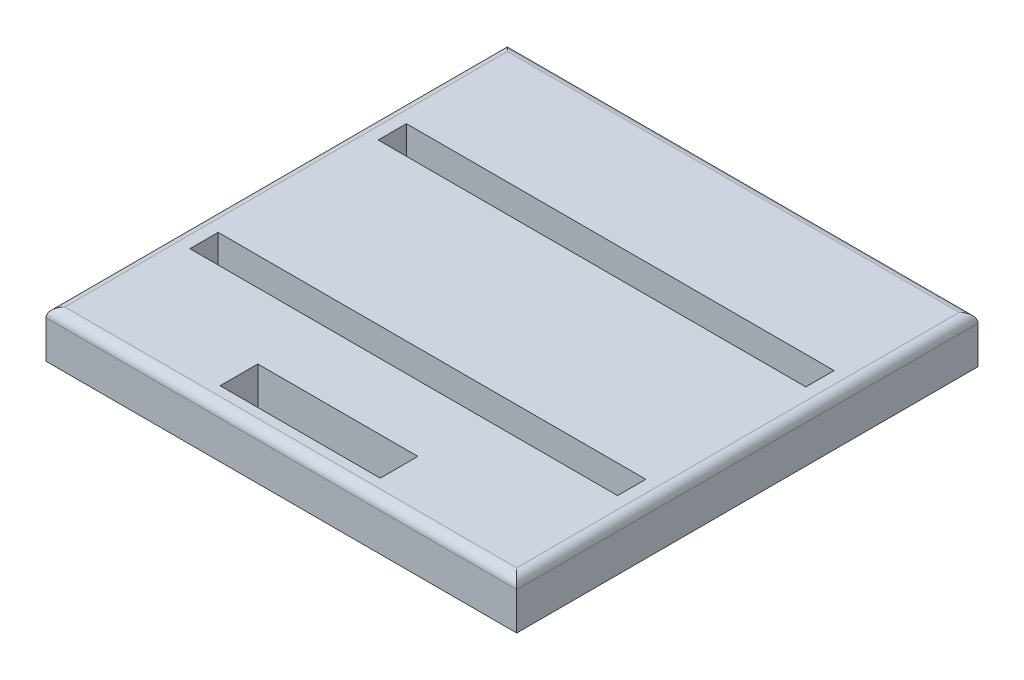
from build123d import *

# Parameters (mm, degrees)
SKETCH2_W           = 127
SKETCH2_H           = 124.46
BOSS_EXTRUDE1_DEPTH = 12.7
FILLET1_R           = 2.54
SKETCH3_W           = 115.38555028
SKETCH3_H           = 7.62
SKETCH3_W_2         = 43.18
SKETCH3_H_2         = 10.16
CUT_EXTRUDE1_DEPTH  = 12.7


with BuildPart() as part:
    # Sketch2 → Boss-Extrude1 (new body)
    with BuildSketch(Plane(origin=(0, 0, 0), x_dir=(1, 0, 0), z_dir=(0, 1, 0))):
        with Locations((0, 19.05)):
            Rectangle(SKETCH2_W, SKETCH2_H)
    extrude(amount=BOSS_EXTRUDE1_DEPTH)

    # Fillet1
    fillet1_edges = [part.edges().sort_by_distance(p)[0] for p in [
        (63.5, 12.7, -19.05),
        (-63.5, 12.7, -19.05),
        (0, 12.7, 43.18),
        (0, 12.7, -81.28),
    ]]
    fillet(fillet1_edges, radius=FILLET1_R)

    # Sketch3 → Cut-Extrude1 (cut)
    with BuildSketch(Plane(origin=(0, 12.7, 0), x_dir=(1, 0, 0), z_dir=(0, 1, 0))):
        with Locations((-2.54e-06, 44.45)):
            Rectangle(SKETCH3_W, SKETCH3_H)
        with Locations((0, -33.02)):
            Rectangle(SKETCH3_W_2, SKETCH3_H_2)
        with Locations((-2.54e-06, -6.35)):
            Rectangle(SKETCH3_W, SKETCH3_H)
    extrude(amount=-CUT_EXTRUDE1_DEPTH, mode=Mode.SUBTRACT)


solid = part.part
